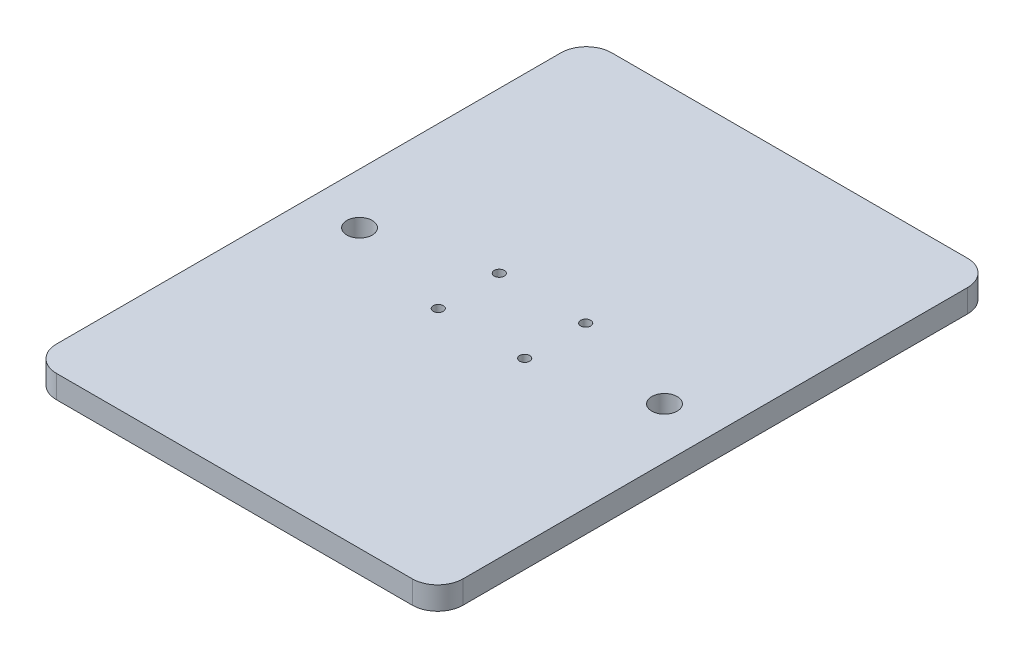
from build123d import *

# Parameters (mm, degrees)
SKETCH1_R           = 1.25
SKETCH1_R_2         = 3.175
BOSS_EXTRUDE1_DEPTH = 5.715


with BuildPart() as part:
    # Sketch1 → Boss-Extrude1 (new body)
    with BuildSketch(Plane(origin=(0, 12.7625, 0), x_dir=(1, 0, 0), z_dir=(0, 1, 0))):
        with BuildLine():
            Line((-44.45, -69.369872981), (44.45, -69.369872981))
            ThreePointArc((44.45, -69.369872981), (48.940128061, -67.510001042), (50.8, -63.019872981))
            Line((50.8, -63.019872981), (50.8, 63.019872981))
            ThreePointArc((50.8, 63.019872981), (48.940128061, 67.510001042), (44.45, 69.369872981))
            Line((44.45, 69.369872981), (-44.45, 69.369872981))
            ThreePointArc((-44.45, 69.369872981), (-48.940128061, 67.510001042), (-50.8, 63.019872981))
            Line((-50.8, 63.019872981), (-50.8, -63.019872981))
            ThreePointArc((-50.8, -63.019872981), (-48.940128061, -67.510001042), (-44.45, -69.369872981))
        make_face()
        with Locations((10.795, 7.62)):
            Circle(SKETCH1_R, mode=Mode.SUBTRACT)
        with Locations((10.795, -7.62)):
            Circle(SKETCH1_R, mode=Mode.SUBTRACT)
        with Locations((-10.795, -7.62)):
            Circle(SKETCH1_R, mode=Mode.SUBTRACT)
        with Locations((-10.795, 7.62)):
            Circle(SKETCH1_R, mode=Mode.SUBTRACT)
        with Locations((38.1, 0)):
            Circle(SKETCH1_R_2, mode=Mode.SUBTRACT)
        with Locations((-38.1, 0)):
            Circle(SKETCH1_R_2, mode=Mode.SUBTRACT)
    extrude(amount=BOSS_EXTRUDE1_DEPTH)


solid = part.part
